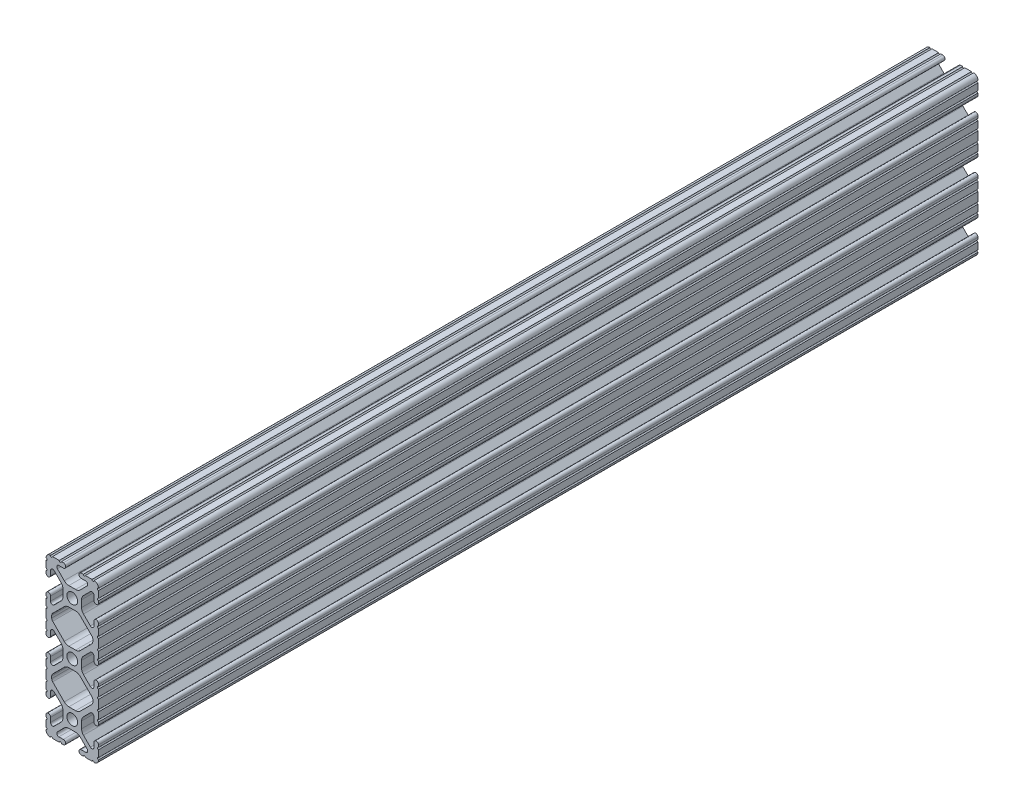
from build123d import *

# Parameters (mm, degrees)
SKETCH1_R           = 2.6035
BOSS_EXTRUDE1_DEPTH = 425.45


with BuildPart() as part:
    # Sketch1 → Boss-Extrude1 (new body)
    with BuildSketch(Plane.XY):
        with BuildLine():
            Line((-6.3246, 38.1), (-9.5504, 38.1))
            ThreePointArc((-9.5504, 38.1), (-10.0584, 37.592), (-10.5664, 38.1))
            ThreePointArc((-10.5664, 38.1), (-12.082677406, 37.482677406), (-12.7, 35.9664))
            ThreePointArc((-12.7, 35.9664), (-12.192, 35.4584), (-12.7, 34.9504))
            Line((-12.7, 34.9504), (-12.7, 31.7246))
            ThreePointArc((-12.7, 31.7246), (-12.192, 31.2166), (-12.7, 30.7086))
            Line((-12.7, 30.7086), (-12.7, 29.702307889))
            ThreePointArc((-12.7, 29.702307889), (-11.5951, 28.597407889), (-10.4902, 29.702307889))
            Line((-10.4902, 29.702307889), (-10.4902, 31.874794456))
            ThreePointArc((-10.4902, 31.874794456), (-9.863006367, 32.813456061), (-8.75577951, 32.593214945))
            Line((-8.75577951, 32.593214945), (-5.43843597, 29.275871405))
            ThreePointArc((-5.43843597, 29.275871405), (-4.750182484, 28.245827272), (-4.5085, 27.030807374))
            Line((-4.5085, 27.030807374), (-4.5085, 23.769192626))
            ThreePointArc((-4.5085, 23.769192626), (-4.750182484, 22.554172728), (-5.43843597, 21.524128595))
            Line((-5.43843597, 21.524128595), (-8.75577951, 18.206785055))
            ThreePointArc((-8.75577951, 18.206785055), (-9.863006367, 17.986543939), (-10.4902, 18.925205544))
            Line((-10.4902, 18.925205544), (-10.4902, 21.097692111))
            ThreePointArc((-10.4902, 21.097692111), (-11.5951, 22.202592111), (-12.7, 21.097692111))
            Line((-12.7, 21.097692111), (-12.7, 20.0914))
            ThreePointArc((-12.7, 20.0914), (-12.192, 19.5834), (-12.7, 19.0754))
            Line((-12.7, 19.0754), (-12.7, 15.8496))
            ThreePointArc((-12.7, 15.8496), (-12.192, 15.3416), (-12.7, 14.8336))
            Line((-12.7, 14.8336), (-12.7, 10.5664))
            ThreePointArc((-12.7, 10.5664), (-12.192, 10.0584), (-12.7, 9.5504))
            Line((-12.7, 9.5504), (-12.7, 6.3246))
            ThreePointArc((-12.7, 6.3246), (-12.192, 5.8166), (-12.7, 5.3086))
            Line((-12.7, 5.3086), (-12.7, 4.302307889))
            ThreePointArc((-12.7, 4.302307889), (-11.5951, 3.197407889), (-10.4902, 4.302307889))
            Line((-10.4902, 4.302307889), (-10.4902, 6.474794456))
            ThreePointArc((-10.4902, 6.474794456), (-9.863006367, 7.413456061), (-8.75577951, 7.193214945))
            Line((-8.75577951, 7.193214945), (-5.43843597, 3.875871405))
            ThreePointArc((-5.43843597, 3.875871405), (-4.750182484, 2.845827272), (-4.5085, 1.630807374))
            Line((-4.5085, 1.630807374), (-4.5085, -1.630807374))
            ThreePointArc((-4.5085, -1.630807374), (-4.750182484, -2.845827272), (-5.43843597, -3.875871405))
            Line((-5.43843597, -3.875871405), (-8.75577951, -7.193214945))
            ThreePointArc((-8.75577951, -7.193214945), (-9.863006367, -7.413456061), (-10.4902, -6.474794456))
            Line((-10.4902, -6.474794456), (-10.4902, -4.302307889))
            ThreePointArc((-10.4902, -4.302307889), (-11.5951, -3.197407889), (-12.7, -4.302307889))
            Line((-12.7, -4.302307889), (-12.7, -5.3086))
            ThreePointArc((-12.7, -5.3086), (-12.192, -5.8166), (-12.7, -6.3246))
            Line((-12.7, -6.3246), (-12.7, -9.5504))
            ThreePointArc((-12.7, -9.5504), (-12.192, -10.0584), (-12.7, -10.5664))
            Line((-12.7, -10.5664), (-12.7, -14.8336))
            ThreePointArc((-12.7, -14.8336), (-12.192, -15.3416), (-12.7, -15.8496))
            Line((-12.7, -15.8496), (-12.7, -19.0754))
            ThreePointArc((-12.7, -19.0754), (-12.192, -19.5834), (-12.7, -20.0914))
            Line((-12.7, -20.0914), (-12.7, -21.097692111))
            ThreePointArc((-12.7, -21.097692111), (-11.5951, -22.202592111), (-10.4902, -21.097692111))
            Line((-10.4902, -21.097692111), (-10.4902, -18.925205544))
            ThreePointArc((-10.4902, -18.925205544), (-9.863006367, -17.986543939), (-8.75577951, -18.206785055))
            Line((-8.75577951, -18.206785055), (-5.43843597, -21.524128595))
            ThreePointArc((-5.43843597, -21.524128595), (-4.750182484, -22.554172728), (-4.5085, -23.769192626))
            Line((-4.5085, -23.769192626), (-4.5085, -27.030807374))
            ThreePointArc((-4.5085, -27.030807374), (-4.750182484, -28.245827272), (-5.43843597, -29.275871405))
            Line((-5.43843597, -29.275871405), (-8.75577951, -32.593214945))
            ThreePointArc((-8.75577951, -32.593214945), (-9.863006367, -32.813456061), (-10.4902, -31.874794456))
            Line((-10.4902, -31.874794456), (-10.4902, -29.702307889))
            ThreePointArc((-10.4902, -29.702307889), (-11.5951, -28.597407889), (-12.7, -29.702307889))
            Line((-12.7, -29.702307889), (-12.7, -30.7086))
            ThreePointArc((-12.7, -30.7086), (-12.192, -31.2166), (-12.7, -31.7246))
            Line((-12.7, -31.7246), (-12.7, -34.9504))
            ThreePointArc((-12.7, -34.9504), (-12.192, -35.4584), (-12.7, -35.9664))
            ThreePointArc((-12.7, -35.9664), (-12.082677406, -37.482677406), (-10.5664, -38.1))
            ThreePointArc((-10.5664, -38.1), (-10.0584, -37.592), (-9.5504, -38.1))
            Line((-9.5504, -38.1), (-6.3246, -38.1))
            ThreePointArc((-6.3246, -38.1), (-5.8166, -37.592), (-5.3086, -38.1))
            Line((-5.3086, -38.1), (-4.302307889, -38.1))
            ThreePointArc((-4.302307889, -38.1), (-3.197407889, -36.9951), (-4.302307889, -35.8902))
            Line((-4.302307889, -35.8902), (-6.474794456, -35.8902))
            ThreePointArc((-6.474794456, -35.8902), (-7.413456061, -35.263006367), (-7.193214945, -34.15577951))
            Line((-7.193214945, -34.15577951), (-3.875871405, -30.83843597))
            ThreePointArc((-3.875871405, -30.83843597), (-2.845827272, -30.150182484), (-1.630807374, -29.9085))
            Line((-1.630807374, -29.9085), (1.630807374, -29.9085))
            ThreePointArc((1.630807374, -29.9085), (2.845827272, -30.150182484), (3.875871405, -30.83843597))
            Line((3.875871405, -30.83843597), (7.193214945, -34.15577951))
            ThreePointArc((7.193214945, -34.15577951), (7.413456061, -35.263006367), (6.474794456, -35.8902))
            Line((6.474794456, -35.8902), (4.302307889, -35.8902))
            ThreePointArc((4.302307889, -35.8902), (3.197407889, -36.9951), (4.302307889, -38.1))
            Line((4.302307889, -38.1), (5.3086, -38.1))
            ThreePointArc((5.3086, -38.1), (5.8166, -37.592), (6.3246, -38.1))
            Line((6.3246, -38.1), (9.5504, -38.1))
            ThreePointArc((9.5504, -38.1), (10.0584, -37.592), (10.5664, -38.1))
            ThreePointArc((10.5664, -38.1), (12.082677406, -37.482677406), (12.7, -35.9664))
            ThreePointArc((12.7, -35.9664), (12.192, -35.4584), (12.7, -34.9504))
            Line((12.7, -34.9504), (12.7, -31.7246))
            ThreePointArc((12.7, -31.7246), (12.192, -31.2166), (12.7, -30.7086))
            Line((12.7, -30.7086), (12.7, -29.702307918))
            ThreePointArc((12.7, -29.702307918), (11.5951, -28.597407918), (10.4902, -29.702307918))
            Line((10.4902, -29.702307918), (10.4902, -31.874794456))
            ThreePointArc((10.4902, -31.874794456), (9.863006367, -32.813456061), (8.75577951, -32.593214945))
            Line((8.75577951, -32.593214945), (5.43843597, -29.275871405))
            ThreePointArc((5.43843597, -29.275871405), (4.750182484, -28.245827272), (4.5085, -27.030807374))
            Line((4.5085, -27.030807374), (4.5085, -23.769192626))
            ThreePointArc((4.5085, -23.769192626), (4.750182484, -22.554172728), (5.43843597, -21.524128595))
            Line((5.43843597, -21.524128595), (8.75577951, -18.206785055))
            ThreePointArc((8.75577951, -18.206785055), (9.863006367, -17.986543939), (10.4902, -18.925205544))
            Line((10.4902, -18.925205544), (10.4902, -21.097692058))
            ThreePointArc((10.4902, -21.097692058), (11.5951, -22.202592058), (12.7, -21.097692058))
            Line((12.7, -21.097692058), (12.7, -20.0914))
            ThreePointArc((12.7, -20.0914), (12.192, -19.5834), (12.7, -19.0754))
            Line((12.7, -19.0754), (12.7, -15.8496))
            ThreePointArc((12.7, -15.8496), (12.192, -15.3416), (12.7, -14.8336))
            Line((12.7, -14.8336), (12.7, -10.5664))
            ThreePointArc((12.7, -10.5664), (12.192, -10.0584), (12.7, -9.5504))
            Line((12.7, -9.5504), (12.7, -6.3246))
            ThreePointArc((12.7, -6.3246), (12.192, -5.8166), (12.7, -5.3086))
            Line((12.7, -5.3086), (12.7, -4.302307889))
            ThreePointArc((12.7, -4.302307889), (11.5951, -3.197407889), (10.4902, -4.302307889))
            Line((10.4902, -4.302307889), (10.4902, -6.474794456))
            ThreePointArc((10.4902, -6.474794456), (9.863006367, -7.413456061), (8.75577951, -7.193214945))
            Line((8.75577951, -7.193214945), (5.43843597, -3.875871405))
            ThreePointArc((5.43843597, -3.875871405), (4.750182484, -2.845827272), (4.5085, -1.630807374))
            Line((4.5085, -1.630807374), (4.5085, 1.630807374))
            ThreePointArc((4.5085, 1.630807374), (4.750182484, 2.845827272), (5.43843597, 3.875871405))
            Line((5.43843597, 3.875871405), (8.75577951, 7.193214945))
            ThreePointArc((8.75577951, 7.193214945), (9.863006367, 7.413456061), (10.4902, 6.474794456))
            Line((10.4902, 6.474794456), (10.4902, 4.302307889))
            ThreePointArc((10.4902, 4.302307889), (11.5951, 3.197407889), (12.7, 4.302307889))
            Line((12.7, 4.302307889), (12.7, 5.3086))
            ThreePointArc((12.7, 5.3086), (12.192, 5.8166), (12.7, 6.3246))
            Line((12.7, 6.3246), (12.7, 9.5504))
            ThreePointArc((12.7, 9.5504), (12.192, 10.0584), (12.7, 10.5664))
            Line((12.7, 10.5664), (12.7, 14.8336))
            ThreePointArc((12.7, 14.8336), (12.192, 15.3416), (12.7, 15.8496))
            Line((12.7, 15.8496), (12.7, 19.0754))
            ThreePointArc((12.7, 19.0754), (12.192, 19.5834), (12.7, 20.0914))
            Line((12.7, 20.0914), (12.7, 21.097692082))
            ThreePointArc((12.7, 21.097692082), (11.5951, 22.202592082), (10.4902, 21.097692082))
            Line((10.4902, 21.097692082), (10.4902, 18.925205544))
            ThreePointArc((10.4902, 18.925205544), (9.863006367, 17.986543939), (8.75577951, 18.206785055))
            Line((8.75577951, 18.206785055), (5.43843597, 21.524128595))
            ThreePointArc((5.43843597, 21.524128595), (4.750182484, 22.554172728), (4.5085, 23.769192626))
            Line((4.5085, 23.769192626), (4.5085, 27.030807374))
            ThreePointArc((4.5085, 27.030807374), (4.750182484, 28.245827272), (5.43843597, 29.275871405))
            Line((5.43843597, 29.275871405), (8.75577951, 32.593214945))
            ThreePointArc((8.75577951, 32.593214945), (9.863006367, 32.813456061), (10.4902, 31.874794456))
            Line((10.4902, 31.874794456), (10.4902, 29.702307889))
            ThreePointArc((10.4902, 29.702307889), (11.5951, 28.597407889), (12.7, 29.702307889))
            Line((12.7, 29.702307889), (12.7, 30.7086))
            ThreePointArc((12.7, 30.7086), (12.192, 31.2166), (12.7, 31.7246))
            Line((12.7, 31.7246), (12.7, 34.9504))
            ThreePointArc((12.7, 34.9504), (12.192, 35.4584), (12.7, 35.9664))
            ThreePointArc((12.7, 35.9664), (12.082677406, 37.482677406), (10.5664, 38.1))
            ThreePointArc((10.5664, 38.1), (10.0584, 37.592), (9.5504, 38.1))
            Line((9.5504, 38.1), (6.3246, 38.1))
            ThreePointArc((6.3246, 38.1), (5.8166, 37.592), (5.3086, 38.1))
            Line((5.3086, 38.1), (4.302307889, 38.1))
            ThreePointArc((4.302307889, 38.1), (3.197407889, 36.9951), (4.302307889, 35.8902))
            Line((4.302307889, 35.8902), (6.474794456, 35.8902))
            ThreePointArc((6.474794456, 35.8902), (7.413456061, 35.263006367), (7.193214945, 34.15577951))
            Line((7.193214945, 34.15577951), (3.875871405, 30.83843597))
            ThreePointArc((3.875871405, 30.83843597), (2.845827272, 30.150182484), (1.630807374, 29.9085))
            Line((1.630807374, 29.9085), (-1.630807374, 29.9085))
            ThreePointArc((-1.630807374, 29.9085), (-2.845827272, 30.150182484), (-3.875871405, 30.83843597))
            Line((-3.875871405, 30.83843597), (-7.193214945, 34.15577951))
            ThreePointArc((-7.193214945, 34.15577951), (-7.413456061, 35.263006367), (-6.474794456, 35.8902))
            Line((-6.474794456, 35.8902), (-4.302307889, 35.8902))
            ThreePointArc((-4.302307889, 35.8902), (-3.197407889, 36.9951), (-4.302307889, 38.1))
            Line((-4.302307889, 38.1), (-5.3086, 38.1))
            ThreePointArc((-5.3086, 38.1), (-5.8166, 37.592), (-6.3246, 38.1))
        make_face()
        with Locations((0, 25.4)):
            Circle(SKETCH1_R, mode=Mode.SUBTRACT)
        with Locations((0, -25.4)):
            Circle(SKETCH1_R, mode=Mode.SUBTRACT)
        Circle(SKETCH1_R, mode=Mode.SUBTRACT)
        with BuildLine():
            Line((-9.9314, 12.146268083), (-9.9314, 13.253731917))
            ThreePointArc((-9.9314, 13.253731917), (-9.811525488, 13.856381786), (-9.470151759, 14.367283676))
            Line((-9.470151759, 14.367283676), (-3.875871405, 19.96156403))
            ThreePointArc((-3.875871405, 19.96156403), (-2.845827272, 20.649817516), (-1.630807374, 20.8915))
            Line((-1.630807374, 20.8915), (1.630807374, 20.8915))
            ThreePointArc((1.630807374, 20.8915), (2.845827272, 20.649817516), (3.875871405, 19.96156403))
            Line((3.875871405, 19.96156403), (9.470151759, 14.367283676))
            ThreePointArc((9.470151759, 14.367283676), (9.811525488, 13.856381786), (9.9314, 13.253731917))
            Line((9.9314, 13.253731917), (9.9314, 12.146268083))
            ThreePointArc((9.9314, 12.146268083), (9.811525488, 11.543618214), (9.470151759, 11.032716324))
            Line((9.470151759, 11.032716324), (3.875871405, 5.43843597))
            ThreePointArc((3.875871405, 5.43843597), (2.845827272, 4.750182484), (1.630807374, 4.5085))
            Line((1.630807374, 4.5085), (-1.630807374, 4.5085))
            ThreePointArc((-1.630807374, 4.5085), (-2.845827272, 4.750182484), (-3.875871405, 5.43843597))
            Line((-3.875871405, 5.43843597), (-9.470151759, 11.032716324))
            ThreePointArc((-9.470151759, 11.032716324), (-9.811525488, 11.543618214), (-9.9314, 12.146268083))
        make_face(mode=Mode.SUBTRACT)
        with BuildLine():
            Line((-9.9314, -13.253731917), (-9.9314, -12.146268083))
            ThreePointArc((-9.9314, -12.146268083), (-9.811525488, -11.543618214), (-9.470151759, -11.032716324))
            Line((-9.470151759, -11.032716324), (-3.875871405, -5.43843597))
            ThreePointArc((-3.875871405, -5.43843597), (-2.845827272, -4.750182484), (-1.630807374, -4.5085))
            Line((-1.630807374, -4.5085), (1.630807374, -4.5085))
            ThreePointArc((1.630807374, -4.5085), (2.845827272, -4.750182484), (3.875871405, -5.43843597))
            Line((3.875871405, -5.43843597), (9.470151759, -11.032716324))
            ThreePointArc((9.470151759, -11.032716324), (9.811525488, -11.543618214), (9.9314, -12.146268083))
            Line((9.9314, -12.146268083), (9.9314, -13.253731917))
            ThreePointArc((9.9314, -13.253731917), (9.811525488, -13.856381786), (9.470151759, -14.367283676))
            Line((9.470151759, -14.367283676), (3.875871405, -19.96156403))
            ThreePointArc((3.875871405, -19.96156403), (2.845827272, -20.649817516), (1.630807374, -20.8915))
            Line((1.630807374, -20.8915), (-1.630807374, -20.8915))
            ThreePointArc((-1.630807374, -20.8915), (-2.845827272, -20.649817516), (-3.875871405, -19.96156403))
            Line((-3.875871405, -19.96156403), (-9.470151759, -14.367283676))
            ThreePointArc((-9.470151759, -14.367283676), (-9.811525488, -13.856381786), (-9.9314, -13.253731917))
        make_face(mode=Mode.SUBTRACT)
    extrude(amount=-BOSS_EXTRUDE1_DEPTH)


solid = part.part
